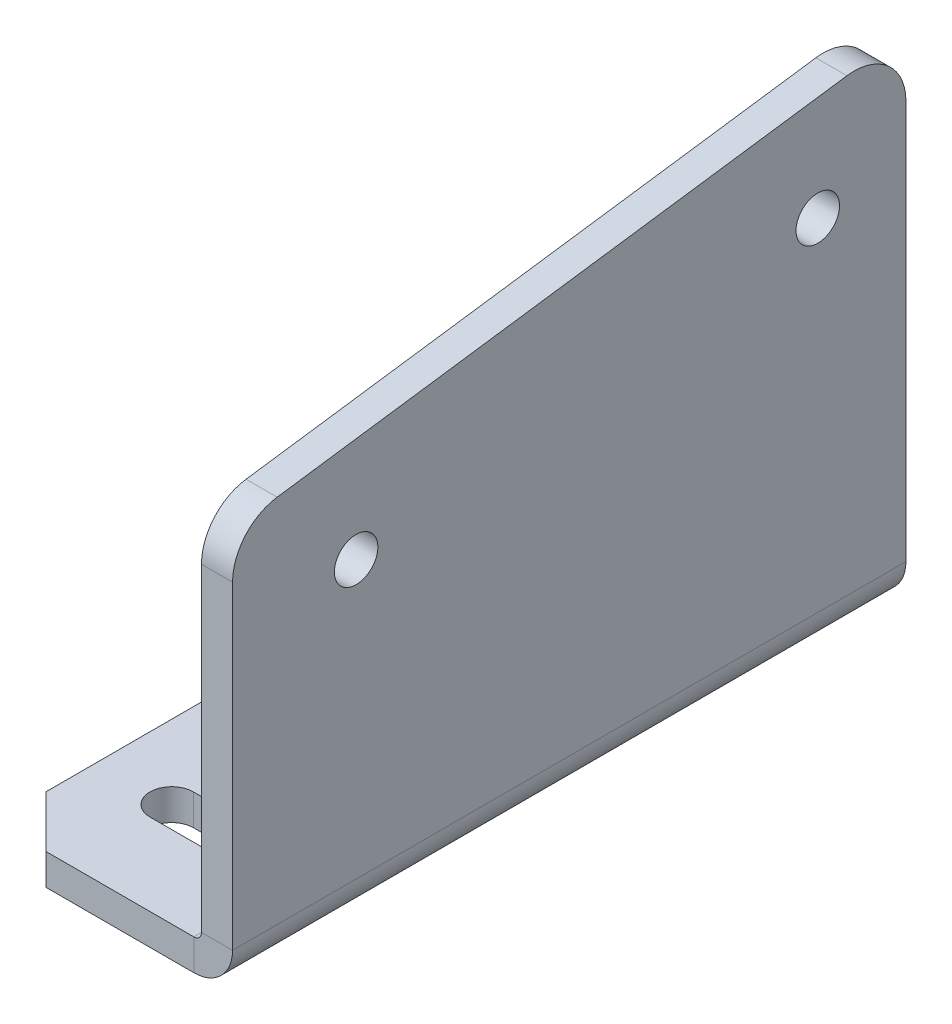
from build123d import *

# Parameters (mm, degrees)
SM_BASE_FLANGE_1_DEPTH = 65
CUT_EXTRUDE_1_DEPTH    = 82.547532152
PATTERN_LINEAR_1_COUNT = 2
PATTERN_LINEAR_1_PITCH = 45
CHAMFER_1_SIZE         = 5
CUT_EXTRUDE_2_DEPTH    = 82.547532152
SKETCH_8_R             = 2.1
CUT_EXTRUDE_3_DEPTH    = 82.547532152
PATTERN_LINEAR_2_COUNT = 2
PATTERN_LINEAR_2_PITCH = 45
FILLET_1_R             = 5


# Sheet-metal steps are written as plain solids
with BuildPart() as part:
    # Sketch 1 → 基材-凸緣1 (new body)
    with BuildSketch(Plane.XY):
        with BuildLine():
            Line((0, 45), (0, 0.7366))
            ThreePointArc((0, 0.7366), (-0.215745145, 0.215745145), (-0.7366, 0))
            Line((-0.7366, 0), (-20, 0))
            Line((-20, 0), (-20, -3))
            Line((-20, -3), (-0.7366, -3))
            ThreePointArc((-0.7366, -3), (1.905575199, -1.905575199), (3, 0.7366))
            Line((3, 0.7366), (3, 45))
            Line((3, 45), (0, 45))
        make_face()
    extrude(amount=SM_BASE_FLANGE_1_DEPTH)

    # 草圖6 → 除料-伸長1 (cut, through all)
    with BuildSketch(Plane(origin=(0, 0, 0), x_dir=(-1, 0, 0), z_dir=(0, 1, 0))):
        with BuildLine():
            Line((7.8683, 57.1), (12.8683, 57.1))
            ThreePointArc((12.8683, 57.1), (14.9683, 55), (12.8683, 52.9))
            Line((12.8683, 52.9), (7.8683, 52.9))
            ThreePointArc((7.8683, 52.9), (5.7683, 55), (7.8683, 57.1))
        make_face()
    cut_extrude_1 = extrude(amount=-CUT_EXTRUDE_1_DEPTH, mode=Mode.SUBTRACT)

    # 直線複製排列1: 除料-伸長1 ×2
    with Locations(*[(0, 0, -i * PATTERN_LINEAR_1_PITCH) for i in range(1, PATTERN_LINEAR_1_COUNT)]):
        add(cut_extrude_1, mode=Mode.SUBTRACT)

    # 導角1
    chamfer_1_edges = [part.edges().sort_by_distance(p)[0] for p in [
        (-20, -1.5, 65),
        (-20, -1.5, 0),
    ]]
    chamfer(chamfer_1_edges, length=CHAMFER_1_SIZE)

    # 草圖7 → 除料-伸長2 (cut, through all)
    with BuildSketch(Plane.ZY):
        Polygon((0, 45), (65, 45), (65, 35.864845744), align=None)
    extrude(amount=-CUT_EXTRUDE_2_DEPTH, mode=Mode.SUBTRACT)

    # 草圖8 → 除料-伸長3 (cut, through all)
    with BuildSketch(Plane.ZY):
        with Locations((8.510949678, 33.705588303)):
            Circle(SKETCH_8_R)
    cut_extrude_3 = extrude(amount=-CUT_EXTRUDE_3_DEPTH, mode=Mode.SUBTRACT)

    # 直線複製排列2: 除料-伸長3 ×2
    with Locations(*[Vector(0, -0.13917310096005842, 0.9902680687415713) * (i * PATTERN_LINEAR_2_PITCH) for i in range(1, PATTERN_LINEAR_2_COUNT)]):
        add(cut_extrude_3, mode=Mode.SUBTRACT)

    # 圓角1
    fillet_1_edges = [part.edges().sort_by_distance(p)[0] for p in [
        (1.5, 35.864845744, 65),
        (1.5, 45, 0),
    ]]
    fillet(fillet_1_edges, radius=FILLET_1_R)


solid = part.part
